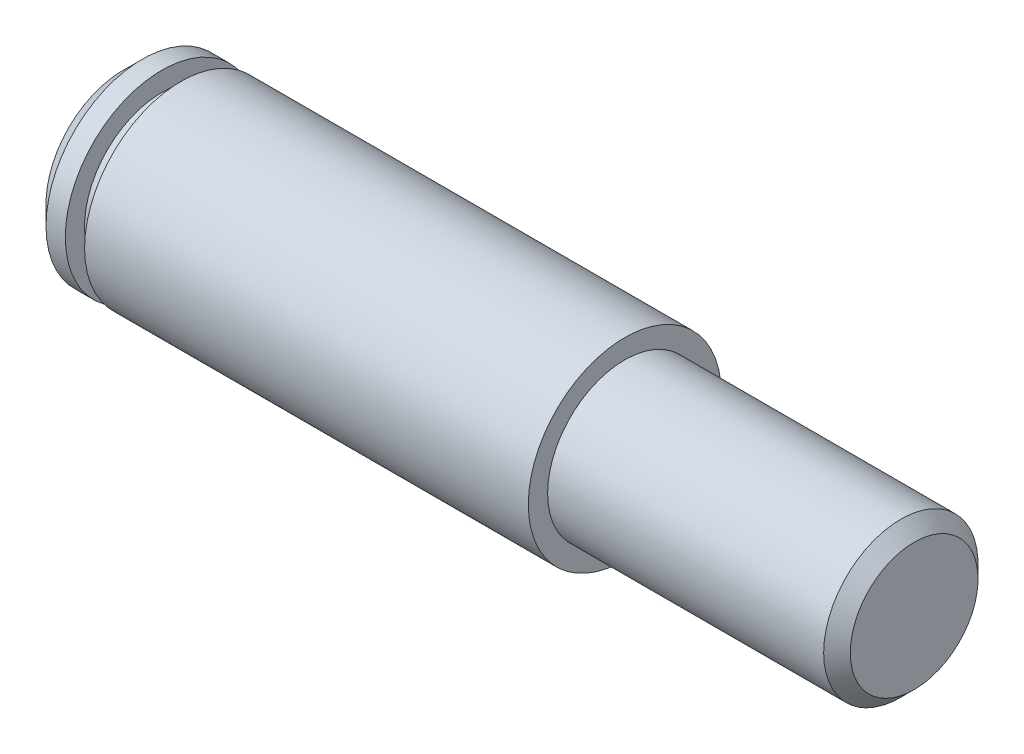
from build123d import *


# Read off the part's stored shape, not the designer's step: M8 Machine Threads Stud1
with BuildPart() as part:
    # Sketch1 → Revolve1 (revolve)
    with BuildSketch(Plane(origin=(0, 0, 0), x_dir=(1, 0, 0), z_dir=(0, 1, 0))):
        Polygon((0, 0), (0, 4), (1, 5), (2, 5), (2, 4), (3, 4), (3, 5), (26, 5), (26, 4.25), (41, 4.25), (41, 0), align=None)
    revolve(axis=Axis((41, 0, 0), (-1, 0, 0)))

    # M8 Machine Threads Stud1 outline → M8 Machine Threads Stud1 (revolve, cut)
    with BuildSketch(Plane.YX):
        Polygon((4.25, 41), (3.3095, 41), (4, 40.3095), (4, 26), (4.25, 26), align=None)
    revolve(axis=Axis((0, 0, 0), (1, 0, 0)), mode=Mode.SUBTRACT)


solid = part.part
